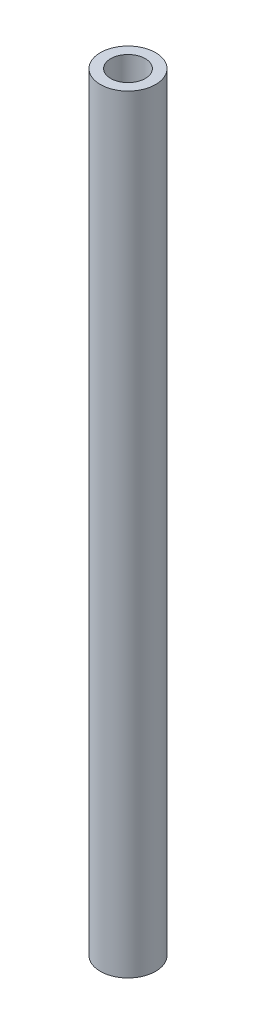
from build123d import *

# Parameters (mm, degrees)
SKETCH1_R           = 1
BOSS_EXTRUDE1_DEPTH = 27.8


with BuildPart() as part:
    # Sketch1 → Boss-Extrude1 (new body)
    with BuildSketch(Plane(origin=(0, 0, 0), x_dir=(1, 0, 0), z_dir=(0, 1, 0))):
        Circle(SKETCH1_R)
    extrude(amount=BOSS_EXTRUDE1_DEPTH)

    # Sketch4 → M1.6x0.35 Tapped Hole1 (revolve, cut)
    with BuildSketch(Plane(origin=(0, 27.8, 0), x_dir=(0, 0, 1), z_dir=(1, 0, 0))):
        Polygon((0, 0), (0, 6.375537887), (0.625, 6), (0.625, 0), align=None)
    m1_6x0_35_tapped_hole1 = revolve(axis=Axis((0, 34.15, 0), (0, -1, 0)), mode=Mode.SUBTRACT)

    # Mirror1: M1.6x0.35 Tapped Hole1 across plane
    add(m1_6x0_35_tapped_hole1.mirror(Plane(origin=(0, 13.9, 0), x_dir=(0, 0, 1), z_dir=(0, -1, 0))), mode=Mode.SUBTRACT)


solid = part.part
